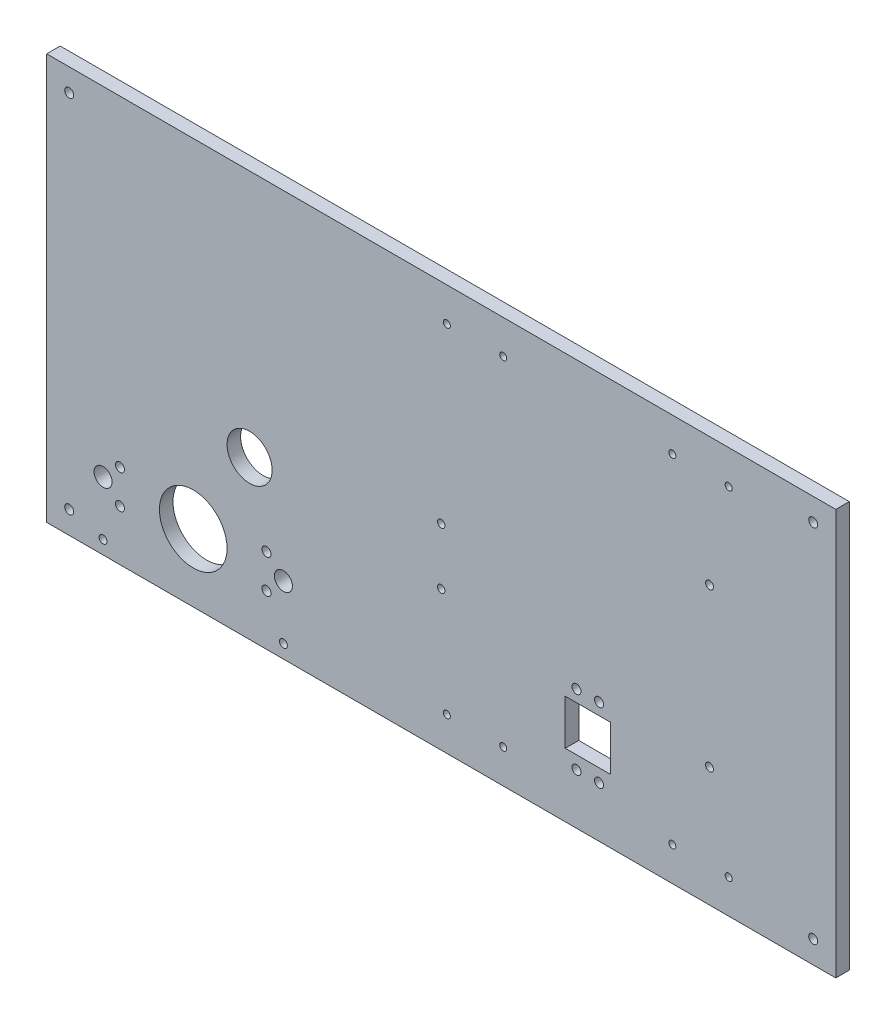
from build123d import *

# Parameters (mm, degrees)
ESBO_O1_W                = 350
ESBO_O1_H                = 180
ESBO_O1_R                = 2
ESBO_O1_R_2              = 4
ESBO_O1_R_3              = 15
ESBO_O1_R_4              = 1.65
ESBO_O1_W_2              = 20
ESBO_O1_H_2              = 20
RESSALTO_EXTRUS_O1_DEPTH = 6
ESBO_O2_R                = 2
ESPACADOR_DEPTH          = 10
ESBO_O3_R                = 2
CORTE_EXTRUS_O2_DEPTH    = 10
ESBO_O4_R                = 1.55
CORTE_EXTRUS_O3_DEPTH    = 10
ESBO_O5_R                = 10
FIOS_DEPTH               = 10
ESBO_O6_R                = 1.75
CORTE_EXTRUS_O5_DEPTH    = 10
ESBO_O7_R                = 1.75
CORTE_EXTRUS_O6_DEPTH    = 10


with BuildPart() as part:
    # Esboço1 → Ressalto-extrusão1 (new body)
    with BuildSketch(Plane.XY):
        Rectangle(ESBO_O1_W, ESBO_O1_H)
        with Locations((-142.5, -67.5)):
            Circle(ESBO_O1_R, mode=Mode.SUBTRACT)
        with Locations((-150, -60)):
            Circle(ESBO_O1_R_2, mode=Mode.SUBTRACT)
        with Locations((-142.5, -52.5)):
            Circle(ESBO_O1_R, mode=Mode.SUBTRACT)
        with Locations((-110, -60)):
            Circle(ESBO_O1_R_3, mode=Mode.SUBTRACT)
        with Locations((-77.5, -67.5)):
            Circle(ESBO_O1_R, mode=Mode.SUBTRACT)
        with Locations((-70, -60)):
            Circle(ESBO_O1_R_2, mode=Mode.SUBTRACT)
        with Locations((-77.5, -52.5)):
            Circle(ESBO_O1_R, mode=Mode.SUBTRACT)
        with Locations((0, -28)):
            Circle(ESBO_O1_R_4, mode=Mode.SUBTRACT)
        with Locations((0, -3)):
            Circle(ESBO_O1_R_4, mode=Mode.SUBTRACT)
        with Locations((65, -51.75)):
            Rectangle(ESBO_O1_W_2, ESBO_O1_H_2, mode=Mode.SUBTRACT)
    extrude(amount=RESSALTO_EXTRUS_O1_DEPTH)

    # Esboço2 → espacador (cut)
    with BuildSketch(Plane.XY.offset(6)):
        with Locations((165, -80)):
            Circle(ESBO_O2_R)
        with Locations((165, 80)):
            Circle(ESBO_O2_R)
        with Locations((-165, 80)):
            Circle(ESBO_O2_R)
        with Locations((-165, -80)):
            Circle(ESBO_O2_R)
    extrude(amount=-ESPACADOR_DEPTH, mode=Mode.SUBTRACT)

    # Esboço3 → Corte-extrusão2 (cut)
    with BuildSketch(Plane.XY.offset(6)):
        with Locations((70, -67.5)):
            Circle(ESBO_O3_R)
        with Locations((70, -36.5)):
            Circle(ESBO_O3_R)
        with Locations((60, -36.5)):
            Circle(ESBO_O3_R)
        with Locations((60, -67.5)):
            Circle(ESBO_O3_R)
    extrude(amount=-CORTE_EXTRUS_O2_DEPTH, mode=Mode.SUBTRACT)

    # Esboço4 → Corte-extrusão3 (cut)
    with BuildSketch(Plane.XY.offset(6)):
        with Locations((102.5, 75)):
            Circle(ESBO_O4_R)
        with Locations((127.5, 75)):
            Circle(ESBO_O4_R)
        with Locations((2.5, 75)):
            Circle(ESBO_O4_R)
        with Locations((27.5, 75)):
            Circle(ESBO_O4_R)
        with Locations((127.5, -75)):
            Circle(ESBO_O4_R)
        with Locations((102.5, -75)):
            Circle(ESBO_O4_R)
        with Locations((2.5, -75)):
            Circle(ESBO_O4_R)
        with Locations((27.5, -75)):
            Circle(ESBO_O4_R)
    extrude(amount=-CORTE_EXTRUS_O3_DEPTH, mode=Mode.SUBTRACT)

    # Esboço5 → fios (cut)
    with BuildSketch(Plane.XY.offset(6)):
        with Locations((-85, -20)):
            Circle(ESBO_O5_R)
    extrude(amount=-FIOS_DEPTH, mode=Mode.SUBTRACT)

    # Esboço6 → Corte-extrusão5 (cut)
    with BuildSketch(Plane.XY.offset(6)):
        with Locations((119, -37)):
            Circle(ESBO_O6_R)
        with Locations((119, 33)):
            Circle(ESBO_O6_R)
    extrude(amount=-CORTE_EXTRUS_O5_DEPTH, mode=Mode.SUBTRACT)

    # Esboço7 → Corte-extrusão6 (cut)
    with BuildSketch(Plane.XY.offset(6)):
        with Locations((-70, -84)):
            Circle(ESBO_O7_R)
        with Locations((-150, -84)):
            Circle(ESBO_O7_R)
    extrude(amount=-CORTE_EXTRUS_O6_DEPTH, mode=Mode.SUBTRACT)


solid = part.part
